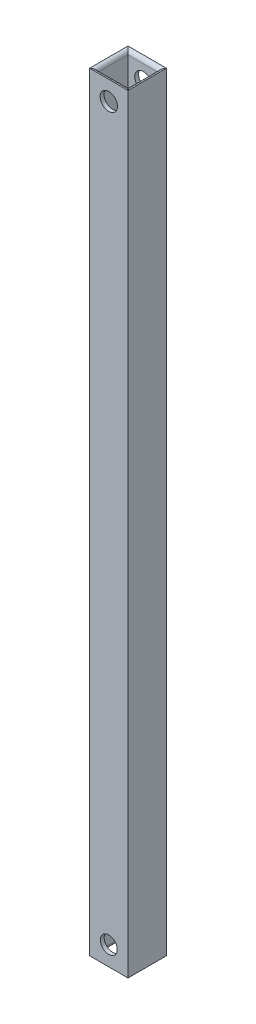
from build123d import *

# Parameters (mm, degrees)
SKETCH1_W           = 10
SKETCH1_H           = 10
SKETCH1_W_2         = 8
SKETCH1_H_2         = 8
BOSS_EXTRUDE1_DEPTH = 200
FILLET2_R           = 1
SKETCH2_R           = 2.2
SKETCH2_R_2         = 2.25
CUT_EXTRUDE1_DEPTH  = 201.31225624


with BuildPart() as part:
    # Sketch1 → Boss-Extrude1 (new body)
    with BuildSketch(Plane(origin=(0, 0, 0), x_dir=(1, 0, 0), z_dir=(0, 1, 0))):
        Rectangle(SKETCH1_W, SKETCH1_H)
        Rectangle(SKETCH1_W_2, SKETCH1_H_2, mode=Mode.SUBTRACT)
    extrude(amount=BOSS_EXTRUDE1_DEPTH)

    # Fillet2
    fillet2_edges = [part.edges().sort_by_distance(p)[0] for p in [
        (4, 0, 0),
        (0, 0, -4),
        (-4, 0, 0),
        (0, 0, 4),
        (4, 200, 0),
        (0, 200, -4),
        (-4, 200, 0),
        (0, 200, 4),
    ]]
    fillet(fillet2_edges, radius=FILLET2_R - 0.0001)  # a hair under: the kernel refuses the full size

    # Sketch2 → Cut-Extrude1 (cut, through all)
    with BuildSketch(Plane.XY.offset(5)):
        with Locations((0, 5)):
            Circle(SKETCH2_R)
        with Locations((0, 195)):
            Circle(SKETCH2_R_2)
    extrude(amount=-CUT_EXTRUDE1_DEPTH, mode=Mode.SUBTRACT)


solid = part.part
